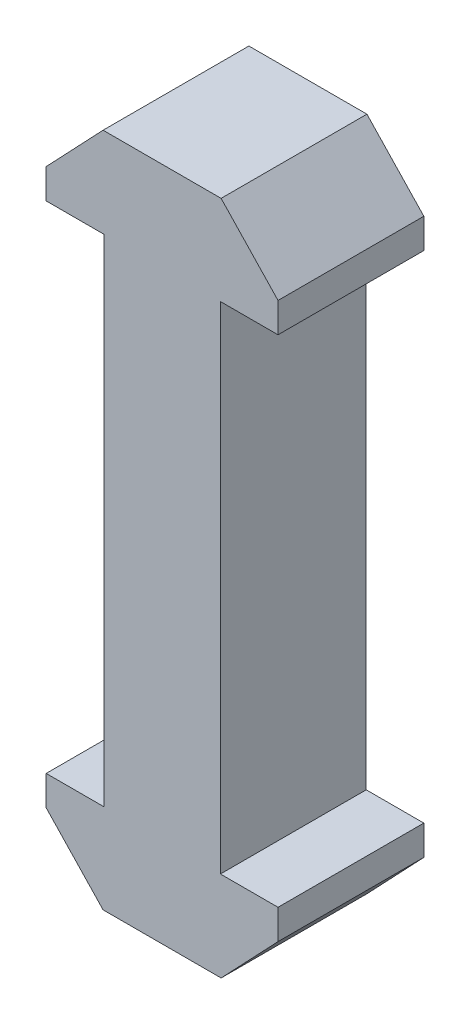
from build123d import *

# Parameters (mm, degrees)
BOSS_EXTRUDE1_DEPTH = 5


with BuildPart() as part:
    # Sketch1 → Boss-Extrude1 (new, symmetric)
    with BuildSketch(Plane.XY):
        Polygon((4, -2.122480699), (4, 31.877519301), (7.95, 31.877519301), (7.95, 33.917519301), (4.048, 38.029934285), (-4.048, 38.029934285), (-7.95, 33.917519301), (-7.95, 31.877519301), (-4, 31.877519301), (-4, -2.122480699), (-7.95, -2.122480699), (-7.95, -4.162480699), (-4.048, -8.274895683), (4.048, -8.274895683), (7.95, -4.162480699), (7.95, -2.122480699), align=None)
    extrude(amount=BOSS_EXTRUDE1_DEPTH, both=True)


solid = part.part
